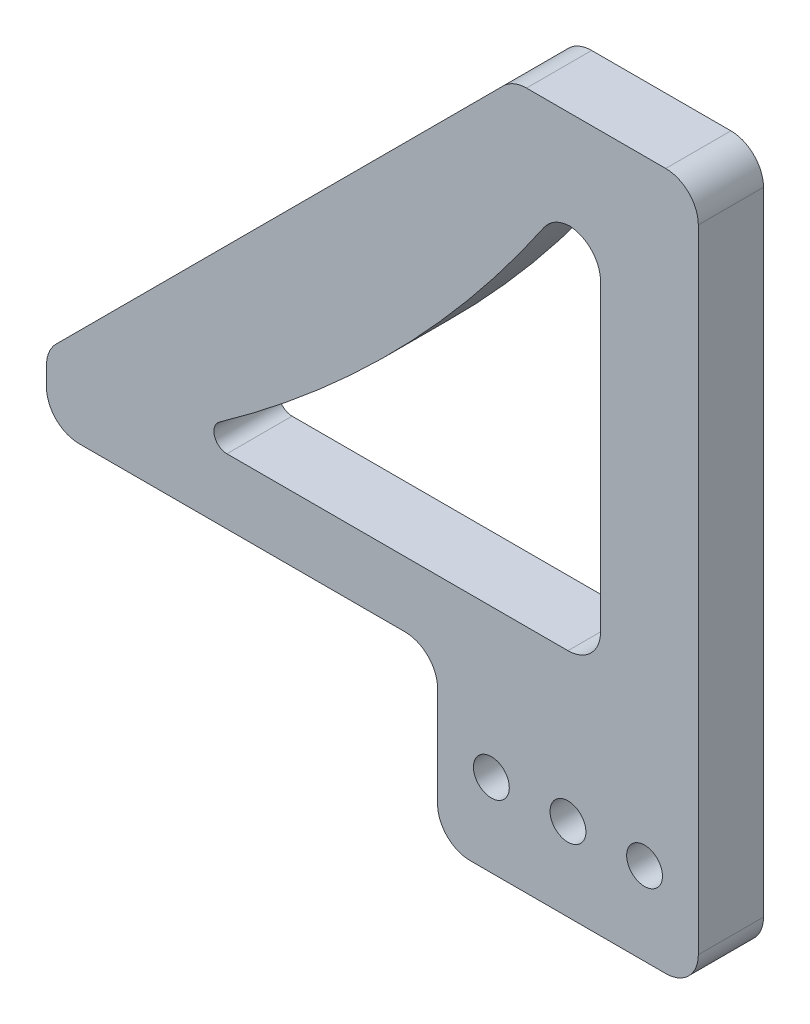
from build123d import *

# Parameters (mm, degrees)
SKETCH1_R           = 2.75
BOSS_EXTRUDE1_DEPTH = 10
FILLET1_R           = 5
FILLET2_R           = 2


with BuildPart() as part:
    # Sketch1 → Boss-Extrude1 (new body)
    with BuildSketch(Plane.XY):
        Polygon((-60, 10), (11.568542495, 81.568542495), (40, 81.568542495), (40, -25.4), (0, -25.4), (0, 0), (-60, 0), align=None)
        with Locations((8.25, -12.7)):
            Circle(SKETCH1_R, mode=Mode.SUBTRACT)
        with Locations((20, -12.7)):
            Circle(SKETCH1_R, mode=Mode.SUBTRACT)
        with Locations((31.75, -12.7)):
            Circle(SKETCH1_R, mode=Mode.SUBTRACT)
        with BuildLine():
            Line((17.781745931, 66.568542495), (25, 66.568542495))
            Line((25, 66.568542495), (25, 10))
            Line((25, 10), (-38.786796564, 10))
            ThreePointArc((-38.786796564, 10), (-7.645233685, 35.426979616), (17.781745931, 66.568542495))
        make_face(mode=Mode.SUBTRACT)
    extrude(amount=BOSS_EXTRUDE1_DEPTH)

    # Fillet1
    # the kernel refuses this fillet: 5 mm, written as the material it adds along each edge
    with BuildSketch(Plane(origin=(17.781745931, 66.568542495, 0), x_dir=(-0.556881790774907, -0.8305917595927212, 0), z_dir=(0, 0, 1))) as fillet1_piece_1:
        with BuildLine():
            CenterArc((2.667557701, 4.999891542), FILLET1_R, 213.840425913, 55.782189142)
            Line((-1.485401097, 2.215482588), (0, 0))
            ThreePointArc((0, 0), (1.317312445, 0.004338327), (2.63462489, 0))
        make_face()
    extrude(amount=10)
    with BuildSketch(Plane(origin=(25, 66.568542495, 0), x_dir=(0, -1, 0), z_dir=(0, 0, 1)), Plane(origin=(25, 10, 0), x_dir=(-1, 0, 0), z_dir=(0, 0, 1)), Plane(origin=(0, 0, 0), x_dir=(0, -1, 0), z_dir=(0, 0, 1))) as fillet1_piece_2:
        with BuildLine():
            CenterArc((FILLET1_R, -FILLET1_R), FILLET1_R, 90, 90)
            Line((0, -FILLET1_R), (0, 0))
            Line((0, 0), (FILLET1_R, 0))
        make_face()
    extrude(amount=10)
    # the kernel refuses this fillet: 5 mm, written as the material it takes off along each edge
    with BuildSketch(Plane(origin=(-60, 0, -12.5), x_dir=(0, 1, 0), z_dir=(0, 0, 1))) as fillet1_2_piece_1:
        with BuildLine():
            CenterArc((FILLET1_R, -FILLET1_R), FILLET1_R, 90, 90)
            Line((0, -FILLET1_R), (0, 0))
            Line((0, 0), (FILLET1_R, 0))
        make_face()
    extrude(amount=35, mode=Mode.SUBTRACT)
    with BuildSketch(Plane(origin=(-60, 10, -5.17766953), x_dir=(0.7071067811865476, 0.7071067811865476, 0), z_dir=(0, 0, 1))) as fillet1_2_piece_2:
        with BuildLine():
            CenterArc((FILLET1_R * 0.414213562373, -FILLET1_R), FILLET1_R, 90, 45)
            Line((-FILLET1_R * 0.292893218813, -FILLET1_R * 0.292893218813), (0, 0))
            Line((0, 0), (FILLET1_R * 0.414213562373, 0))
        make_face()
    extrude(amount=20.355339059, mode=Mode.SUBTRACT)
    with BuildSketch(Plane(origin=(0, -25.4, -12.5), x_dir=(1, 0, 0), z_dir=(0, 0, 1)), Plane(origin=(40, -25.4, -12.5), x_dir=(0, 1, 0), z_dir=(0, 0, 1)), Plane(origin=(40, 81.568542495, -12.5), x_dir=(-1, 0, 0), z_dir=(0, 0, 1))) as fillet1_2_piece_3:
        with BuildLine():
            CenterArc((FILLET1_R, FILLET1_R), FILLET1_R, 180, 90)
            Line((0, FILLET1_R), (0, 0))
            Line((0, 0), (FILLET1_R, 0))
        make_face()
    extrude(amount=35, mode=Mode.SUBTRACT)
    with BuildSketch(Plane(origin=(11.568542495, 81.568542495, -5.17766953), x_dir=(-0.7071067811865509, -0.707106781186544, 0), z_dir=(0, 0, 1))) as fillet1_2_piece_4:
        with BuildLine():
            CenterArc((FILLET1_R * 0.414213562373, FILLET1_R), FILLET1_R, 225, 45)
            Line((-FILLET1_R * 0.292893218813, FILLET1_R * 0.292893218813), (0, 0))
            Line((0, 0), (FILLET1_R * 0.414213562373, 0))
        make_face()
    extrude(amount=20.355339059, mode=Mode.SUBTRACT)

    # Fillet2
    fillet2_edges = [part.edges().sort_by_distance(p)[0] for p in [
        (-38.786796564, 10, 5),
    ]]
    fillet(fillet2_edges, radius=FILLET2_R)


solid = part.part
